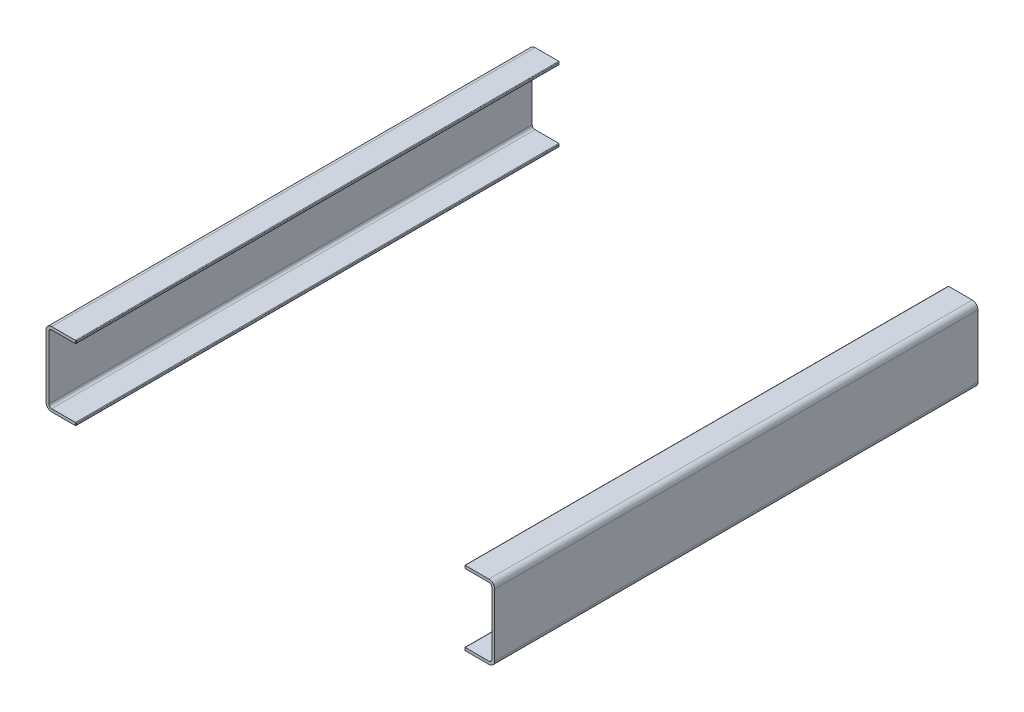
from build123d import *

# Parameters (mm, degrees)
SKETCH6_W           = 306
SKETCH6_H           = 46.8
BOSS_EXTRUDE2_DEPTH = 19
SKETCH7_W           = 17.2
SKETCH7_H           = 43.2
CUT_EXTRUDE2_DEPTH  = 339.153160565
FILLET4_R           = 0.4
FILLET5_R           = 1.8
FILLET6_R           = 3.6
SKETCH12_W          = 306
SKETCH12_H          = 46.8
BOSS_EXTRUDE3_DEPTH = 19
SKETCH13_W          = 17.2
SKETCH13_H          = 43.2
CUT_EXTRUDE3_DEPTH  = 339.153160565
FILLET7_R           = 0.4
FILLET8_R           = 1.8
FILLET9_R           = 3.6


with BuildPart() as part:
    # Sketch6 → Boss-Extrude2 (new body)
    with BuildSketch(Plane.ZY.offset(-123)):
        Rectangle(SKETCH6_W, SKETCH6_H)
    extrude(amount=-BOSS_EXTRUDE2_DEPTH)

    # Sketch7 → Cut-Extrude2 (cut, through all)
    with BuildSketch(Plane.XY.offset(153)):
        with Locations((131.6, 0)):
            Rectangle(SKETCH7_W, SKETCH7_H)
    extrude(amount=-CUT_EXTRUDE2_DEPTH, mode=Mode.SUBTRACT)

    # Fillet4
    fillet4_edges = [part.edges().sort_by_distance(p)[0] for p in [
        (123, -22.5, -153),
        (123, -21.6, 0),
        (123, -23.4, 0),
        (123, -22.5, 153),
        (123, 21.6, 0),
        (123, 22.5, 153),
        (123, 22.5, -153),
        (123, 23.4, 0),
    ]]
    fillet(fillet4_edges, radius=FILLET4_R)

    # Fillet5
    fillet5_edges = [part.edges().sort_by_distance(p)[0] for p in [
        (140.2, 21.6, 0),
        (140.2, -21.6, 0),
    ]]
    fillet(fillet5_edges, radius=FILLET5_R)

    # Fillet6
    fillet6_edges = [part.edges().sort_by_distance(p)[0] for p in [
        (142, -23.4, 0),
        (142, 23.4, 0),
    ]]
    fillet(fillet6_edges, radius=FILLET6_R)


with BuildPart() as body_2:
    # Sketch12 → Boss-Extrude3 (new body)
    with BuildSketch(Plane(origin=(-123, 0, 0), x_dir=(0, 0, -1), z_dir=(1, 0, 0))):
        Rectangle(SKETCH12_W, SKETCH12_H)
    extrude(amount=-BOSS_EXTRUDE3_DEPTH)

    # Sketch13 → Cut-Extrude3 (cut, through all)
    with BuildSketch(Plane.XY.offset(153)):
        with Locations((-131.6, 0)):
            Rectangle(SKETCH13_W, SKETCH13_H)
    extrude(amount=-CUT_EXTRUDE3_DEPTH, mode=Mode.SUBTRACT)

    # Fillet7
    fillet7_edges = [body_2.edges().sort_by_distance(p)[0] for p in [
        (-123, 23.4, 0),
        (-123, 22.5, 153),
        (-123, 22.5, -153),
        (-123, 21.6, 0),
        (-123, -22.5, -153),
        (-123, -23.4, 0),
        (-123, -22.5, 153),
        (-123, -21.6, 0),
    ]]
    fillet(fillet7_edges, radius=FILLET7_R)

    # Fillet8
    fillet8_edges = [body_2.edges().sort_by_distance(p)[0] for p in [
        (-140.2, 21.6, 0),
        (-140.2, -21.6, 0),
    ]]
    fillet(fillet8_edges, radius=FILLET8_R)

    # Fillet9
    fillet9_edges = [body_2.edges().sort_by_distance(p)[0] for p in [
        (-142, -23.4, 0),
        (-142, 23.4, 0),
    ]]
    fillet(fillet9_edges, radius=FILLET9_R)


solid = Compound([part.part, body_2.part])
